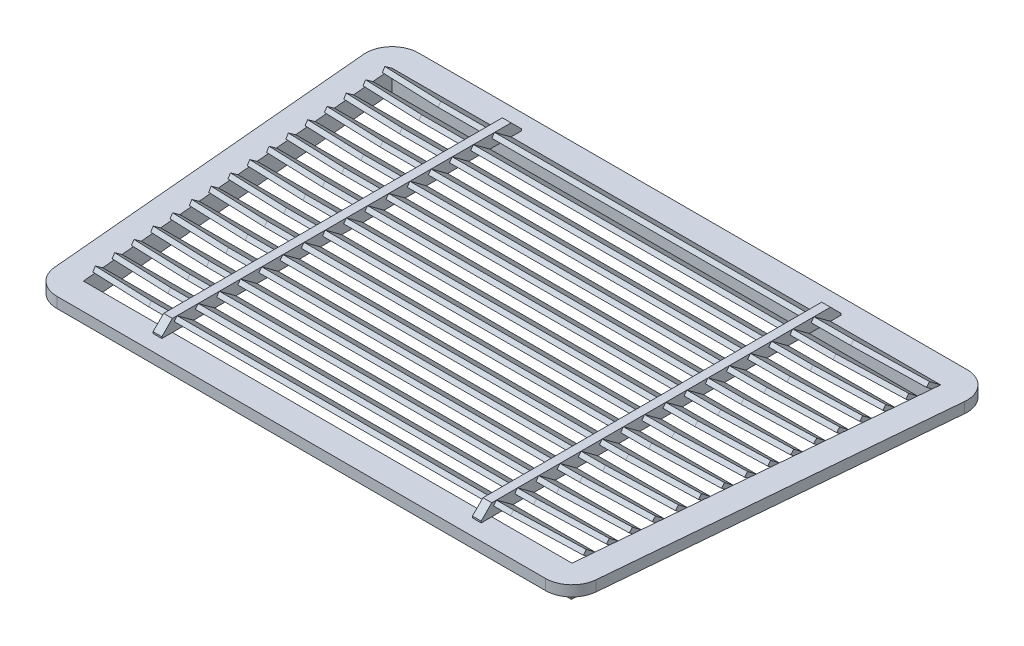
from build123d import *

# Parameters (mm, degrees)
SURFACE_EXTRUDE1_1_BACK         = 40
SURFACE_EXTRUDE1_1_DEPTH        = 40
THICKEN1_T1                     = 20
THICKEN2_START                  = -20
THICKEN2_DEPTH                  = 20
FILLET1_R                       = 50
BOSS_EXTRUDE2_REACH             = 681.192
BOSS_EXTRUDE2_DIRECTION_2_REACH = 681.192
SKETCH8_W                       = 16.546717582
SKETCH8_H                       = 23.062077859
BOSS_EXTRUDE5_DEPTH             = 680
BOSS_EXTRUDE5_2_DEPTH           = 680
CHAMFER1_SIZE                   = 20
CHAMFER2_SIZE                   = 20
CHAMFER3_SIZE                   = 20
CHAMFER4_SIZE                   = 20
CHAMFER5_SIZE                   = 130
CHAMFER5_SIZE2                  = 15
CHAMFER6_SIZE                   = 120
CHAMFER6_SIZE2                  = 20
CHAMFER7_SIZE                   = 120
CHAMFER7_SIZE2                  = 20
CHAMFER8_SIZE                   = 120
CHAMFER8_SIZE2                  = 20
CHAMFER9_SIZE                   = 120
CHAMFER9_SIZE2                  = 20
CHAMFER10_SIZE                  = 120
CHAMFER10_SIZE2                 = 20
CHAMFER11_SIZE                  = 120
CHAMFER11_SIZE2                 = 20
CHAMFER12_SIZE                  = 120
CHAMFER12_SIZE2                 = 20
CHAMFER13_SIZE                  = 120
CHAMFER13_SIZE2                 = 20
CHAMFER14_SIZE                  = 120
CHAMFER14_SIZE2                 = 20
CHAMFER16_SIZE                  = 120
CHAMFER16_SIZE2                 = 20
CHAMFER17_SIZE                  = 120
CHAMFER17_SIZE2                 = 20
CHAMFER18_SIZE                  = 120
CHAMFER18_SIZE2                 = 20
CHAMFER19_SIZE                  = 120
CHAMFER19_SIZE2                 = 20
CHAMFER20_SIZE                  = 120
CHAMFER20_SIZE2                 = 20
CHAMFER21_SIZE                  = 120
CHAMFER21_SIZE2                 = 20
CHAMFER22_SIZE                  = 20
CHAMFER22_SIZE2                 = 120
CHAMFER23_SIZE                  = 20
CHAMFER23_SIZE2                 = 120
CHAMFER24_SIZE                  = 20
CHAMFER24_SIZE2                 = 120
CHAMFER25_SIZE                  = 20
CHAMFER25_SIZE2                 = 120
CHAMFER26_SIZE                  = 20
CHAMFER26_SIZE2                 = 120
CHAMFER27_SIZE                  = 20
CHAMFER27_SIZE2                 = 120
CHAMFER28_SIZE                  = 20
CHAMFER28_SIZE2                 = 120
CHAMFER29_SIZE                  = 20
CHAMFER29_SIZE2                 = 120
CHAMFER30_SIZE                  = 20
CHAMFER30_SIZE2                 = 120
CHAMFER31_SIZE                  = 20
CHAMFER31_SIZE2                 = 120
CHAMFER32_SIZE                  = 20
CHAMFER32_SIZE2                 = 120
CHAMFER33_SIZE                  = 20
CHAMFER33_SIZE2                 = 120
CHAMFER34_SIZE                  = 20
CHAMFER34_SIZE2                 = 120
CHAMFER35_SIZE                  = 20
CHAMFER35_SIZE2                 = 120
CHAMFER36_SIZE                  = 20
CHAMFER36_SIZE2                 = 120
CHAMFER37_SIZE                  = 20
CHAMFER37_SIZE2                 = 120


# Read off the part's stored shape, not the designer's step: Thicken2
with BuildPart() as body_1:
    # Surface-Extrude1: a surface, the sketch's curves swept straight by 40 mm
    with BuildLine(Plane(origin=(0, 0, 0), x_dir=(1, 0, 0), z_dir=(0, 1, 0)).offset(-SURFACE_EXTRUDE1_1_BACK), mode=Mode.PRIVATE) as surface_extrude1_1_path:
        Line((-540, 340), (-479.972491182, -340))
        Line((-479.972491182, -340), (479.972491182, -340))
        Line((479.972491182, -340), (540, 340))
        Line((540, 340), (-540, 340))
    surface_extrude1_1 = Shell.extrude(surface_extrude1_1_path.wire(), (0 * SURFACE_EXTRUDE1_1_DEPTH, 1 * SURFACE_EXTRUDE1_1_DEPTH, 0 * SURFACE_EXTRUDE1_1_DEPTH))
    add(Solid.thicken(surface_extrude1_1, THICKEN1_T1))

    # Thicken2 outline → Thicken2 (add)
    with BuildSketch(Plane(origin=(0, 0, 0), x_dir=(1, 0, 0), z_dir=(0, 1, 0)).offset(THICKEN2_START)):
        Polygon((572.764934729, 370), (-572.764934729, 370), (-507.440881015, -370), (507.440881015, -370), align=None)
        Polygon((-479.972491182, -340), (-540, 340), (540, 340), (479.972491182, -340), align=None, mode=Mode.SUBTRACT)
    extrude(amount=THICKEN2_DEPTH)

    # Fillet1
    fillet1_edges = [body_1.edges().sort_by_distance(p)[0] for p in [
        (-507.440881015, -10, 370),
        (507.440881015, -10, 370),
        (572.764934729, -10, -370),
        (-572.764934729, -10, -370),
    ]]
    fillet(fillet1_edges, radius=FILLET1_R)


with BuildPart() as body_2:
    # Boss-Extrude2: up to this plane
    boss_extrude2_end = Plane(origin=(-520.077473579, 0, -341.758675927), z_dir=(0.9961263210350938, 0, -0.08793379635321903))
    # Sketch6 → Boss-Extrude2 (new, up to the surface)
    with BuildSketch(Plane.ZY, mode=Mode.PRIVATE) as boss_extrude2_sk1:
        Polygon((-320, 0), (-288.774260309, 23.062077859), (-283.541502877, 15.976995481), (-314.767242567, -7.085082378), align=None)
    boss_extrude2_tool1 = split(extrude(boss_extrude2_sk1.sketch, amount=BOSS_EXTRUDE2_REACH, mode=Mode.PRIVATE), bisect_by=boss_extrude2_end, keep=Keep.BOTH, mode=Mode.PRIVATE)
    add(boss_extrude2_tool1.solids().sort_by_distance((0, 7.988498, -301.770751))[0])
    # Sketch6 → Boss-Extrude2 (new, up to the surface)
    with BuildSketch(Plane.ZY, mode=Mode.PRIVATE) as boss_extrude2_sk2:
        Polygon((-280, 0), (-248.774260309, 23.062077859), (-243.541502877, 15.976995481), (-274.767242567, -7.085082378), align=None)
    boss_extrude2_tool2 = split(extrude(boss_extrude2_sk2.sketch, amount=BOSS_EXTRUDE2_REACH, mode=Mode.PRIVATE), bisect_by=boss_extrude2_end, keep=Keep.BOTH, mode=Mode.PRIVATE)
    add(boss_extrude2_tool2.solids().sort_by_distance((0, 7.988498, -261.770751))[0])
    # Sketch6 → Boss-Extrude2 (new, up to the surface)
    with BuildSketch(Plane.ZY, mode=Mode.PRIVATE) as boss_extrude2_sk3:
        Polygon((-240, 0), (-208.774260309, 23.062077859), (-203.541502877, 15.976995481), (-234.767242567, -7.085082378), align=None)
    boss_extrude2_tool3 = split(extrude(boss_extrude2_sk3.sketch, amount=BOSS_EXTRUDE2_REACH, mode=Mode.PRIVATE), bisect_by=boss_extrude2_end, keep=Keep.BOTH, mode=Mode.PRIVATE)
    add(boss_extrude2_tool3.solids().sort_by_distance((0, 7.988498, -221.770751))[0])
    # Sketch6 → Boss-Extrude2 (new, up to the surface)
    with BuildSketch(Plane.ZY, mode=Mode.PRIVATE) as boss_extrude2_sk4:
        Polygon((-200, 0), (-168.774260309, 23.062077859), (-163.541502877, 15.976995481), (-194.767242567, -7.085082378), align=None)
    boss_extrude2_tool4 = split(extrude(boss_extrude2_sk4.sketch, amount=BOSS_EXTRUDE2_REACH, mode=Mode.PRIVATE), bisect_by=boss_extrude2_end, keep=Keep.BOTH, mode=Mode.PRIVATE)
    add(boss_extrude2_tool4.solids().sort_by_distance((0, 7.988498, -181.770751))[0])
    # Sketch6 → Boss-Extrude2 (new, up to the surface)
    with BuildSketch(Plane.ZY, mode=Mode.PRIVATE) as boss_extrude2_sk5:
        Polygon((-160, 0), (-128.774260309, 23.062077859), (-123.541502877, 15.976995481), (-154.767242567, -7.085082378), align=None)
    boss_extrude2_tool5 = split(extrude(boss_extrude2_sk5.sketch, amount=BOSS_EXTRUDE2_REACH, mode=Mode.PRIVATE), bisect_by=boss_extrude2_end, keep=Keep.BOTH, mode=Mode.PRIVATE)
    add(boss_extrude2_tool5.solids().sort_by_distance((0, 7.988498, -141.770751))[0])
    # Sketch6 → Boss-Extrude2 (new, up to the surface)
    with BuildSketch(Plane.ZY, mode=Mode.PRIVATE) as boss_extrude2_sk6:
        Polygon((-120, 0), (-88.774260309, 23.062077859), (-83.541502877, 15.976995481), (-114.767242567, -7.085082378), align=None)
    boss_extrude2_tool6 = split(extrude(boss_extrude2_sk6.sketch, amount=BOSS_EXTRUDE2_REACH, mode=Mode.PRIVATE), bisect_by=boss_extrude2_end, keep=Keep.BOTH, mode=Mode.PRIVATE)
    add(boss_extrude2_tool6.solids().sort_by_distance((0, 7.988498, -101.770751))[0])
    # Sketch6 → Boss-Extrude2 (new, up to the surface)
    with BuildSketch(Plane.ZY, mode=Mode.PRIVATE) as boss_extrude2_sk7:
        Polygon((-80, 0), (-48.774260309, 23.062077859), (-43.541502877, 15.976995481), (-74.767242567, -7.085082378), align=None)
    boss_extrude2_tool7 = split(extrude(boss_extrude2_sk7.sketch, amount=BOSS_EXTRUDE2_REACH, mode=Mode.PRIVATE), bisect_by=boss_extrude2_end, keep=Keep.BOTH, mode=Mode.PRIVATE)
    add(boss_extrude2_tool7.solids().sort_by_distance((0, 7.988498, -61.770751))[0])
    # Sketch6 → Boss-Extrude2 (new, up to the surface)
    with BuildSketch(Plane.ZY, mode=Mode.PRIVATE) as boss_extrude2_sk8:
        Polygon((-40, 0), (-8.774260309, 23.062077859), (-3.541502877, 15.976995481), (-34.767242567, -7.085082378), align=None)
    boss_extrude2_tool8 = split(extrude(boss_extrude2_sk8.sketch, amount=BOSS_EXTRUDE2_REACH, mode=Mode.PRIVATE), bisect_by=boss_extrude2_end, keep=Keep.BOTH, mode=Mode.PRIVATE)
    add(boss_extrude2_tool8.solids().sort_by_distance((0, 7.988498, -21.770751))[0])
    # Sketch6 → Boss-Extrude2 (new, up to the surface)
    with BuildSketch(Plane.ZY, mode=Mode.PRIVATE) as boss_extrude2_sk9:
        Polygon((0, 0), (31.225739691, 23.062077859), (36.458497123, 15.976995481), (5.232757433, -7.085082378), align=None)
    boss_extrude2_tool9 = split(extrude(boss_extrude2_sk9.sketch, amount=BOSS_EXTRUDE2_REACH, mode=Mode.PRIVATE), bisect_by=boss_extrude2_end, keep=Keep.BOTH, mode=Mode.PRIVATE)
    add(boss_extrude2_tool9.solids().sort_by_distance((0, 7.988498, 18.229249))[0])
    # Sketch6 → Boss-Extrude2 (new, up to the surface)
    with BuildSketch(Plane.ZY, mode=Mode.PRIVATE) as boss_extrude2_sk10:
        Polygon((40, 0), (71.225739691, 23.062077859), (76.458497123, 15.976995481), (45.232757433, -7.085082378), align=None)
    boss_extrude2_tool10 = split(extrude(boss_extrude2_sk10.sketch, amount=BOSS_EXTRUDE2_REACH, mode=Mode.PRIVATE), bisect_by=boss_extrude2_end, keep=Keep.BOTH, mode=Mode.PRIVATE)
    add(boss_extrude2_tool10.solids().sort_by_distance((0, 7.988498, 58.229249))[0])
    # Sketch6 → Boss-Extrude2 (new, up to the surface)
    with BuildSketch(Plane.ZY, mode=Mode.PRIVATE) as boss_extrude2_sk11:
        Polygon((80, 0), (111.225739691, 23.062077859), (116.458497123, 15.976995481), (85.232757433, -7.085082378), align=None)
    boss_extrude2_tool11 = split(extrude(boss_extrude2_sk11.sketch, amount=BOSS_EXTRUDE2_REACH, mode=Mode.PRIVATE), bisect_by=boss_extrude2_end, keep=Keep.BOTH, mode=Mode.PRIVATE)
    add(boss_extrude2_tool11.solids().sort_by_distance((0, 7.988498, 98.229249))[0])
    # Sketch6 → Boss-Extrude2 (new, up to the surface)
    with BuildSketch(Plane.ZY, mode=Mode.PRIVATE) as boss_extrude2_sk12:
        Polygon((120, 0), (151.225739691, 23.062077859), (156.458497123, 15.976995481), (125.232757433, -7.085082378), align=None)
    boss_extrude2_tool12 = split(extrude(boss_extrude2_sk12.sketch, amount=BOSS_EXTRUDE2_REACH, mode=Mode.PRIVATE), bisect_by=boss_extrude2_end, keep=Keep.BOTH, mode=Mode.PRIVATE)
    add(boss_extrude2_tool12.solids().sort_by_distance((0, 7.988498, 138.229249))[0])
    # Sketch6 → Boss-Extrude2 (new, up to the surface)
    with BuildSketch(Plane.ZY, mode=Mode.PRIVATE) as boss_extrude2_sk13:
        Polygon((160, 0), (191.225739691, 23.062077859), (196.458497123, 15.976995481), (165.232757433, -7.085082378), align=None)
    boss_extrude2_tool13 = split(extrude(boss_extrude2_sk13.sketch, amount=BOSS_EXTRUDE2_REACH, mode=Mode.PRIVATE), bisect_by=boss_extrude2_end, keep=Keep.BOTH, mode=Mode.PRIVATE)
    add(boss_extrude2_tool13.solids().sort_by_distance((0, 7.988498, 178.229249))[0])
    # Sketch6 → Boss-Extrude2 (new, up to the surface)
    with BuildSketch(Plane.ZY, mode=Mode.PRIVATE) as boss_extrude2_sk14:
        Polygon((200, 0), (231.225739691, 23.062077859), (236.458497123, 15.976995481), (205.232757433, -7.085082378), align=None)
    boss_extrude2_tool14 = split(extrude(boss_extrude2_sk14.sketch, amount=BOSS_EXTRUDE2_REACH, mode=Mode.PRIVATE), bisect_by=boss_extrude2_end, keep=Keep.BOTH, mode=Mode.PRIVATE)
    add(boss_extrude2_tool14.solids().sort_by_distance((0, 7.988498, 218.229249))[0])
    # Sketch6 → Boss-Extrude2 (new, up to the surface)
    with BuildSketch(Plane.ZY, mode=Mode.PRIVATE) as boss_extrude2_sk15:
        Polygon((240, 0), (271.225739691, 23.062077859), (276.458497123, 15.976995481), (245.232757433, -7.085082378), align=None)
    boss_extrude2_tool15 = split(extrude(boss_extrude2_sk15.sketch, amount=BOSS_EXTRUDE2_REACH, mode=Mode.PRIVATE), bisect_by=boss_extrude2_end, keep=Keep.BOTH, mode=Mode.PRIVATE)
    add(boss_extrude2_tool15.solids().sort_by_distance((0, 7.988498, 258.229249))[0])
    # Sketch6 → Boss-Extrude2 (new, up to the surface)
    with BuildSketch(Plane.ZY, mode=Mode.PRIVATE) as boss_extrude2_sk16:
        Polygon((280, 0), (311.225739691, 23.062077859), (316.458497123, 15.976995481), (285.232757433, -7.085082378), align=None)
    boss_extrude2_tool16 = split(extrude(boss_extrude2_sk16.sketch, amount=BOSS_EXTRUDE2_REACH, mode=Mode.PRIVATE), bisect_by=boss_extrude2_end, keep=Keep.BOTH, mode=Mode.PRIVATE)
    add(boss_extrude2_tool16.solids().sort_by_distance((0, 7.988498, 298.229249))[0])

    # Boss-Extrude2 direction 2: up to this plane
    boss_extrude2_direction_2_end = Plane(origin=(460.049964761, 0, 338.241324073), z_dir=(-0.9961263210350938, 0, -0.08793379635321853))
    # Sketch6 → Boss-Extrude2 direction 2 (add, up to the surface)
    with BuildSketch(Plane.ZY, mode=Mode.PRIVATE) as boss_extrude2_direction_2_sk1:
        Polygon((-320, 0), (-288.774260309, 23.062077859), (-283.541502877, 15.976995481), (-314.767242567, -7.085082378), align=None)
    boss_extrude2_direction_2_tool1 = split(extrude(boss_extrude2_direction_2_sk1.sketch, amount=-BOSS_EXTRUDE2_DIRECTION_2_REACH, mode=Mode.PRIVATE), bisect_by=boss_extrude2_direction_2_end, keep=Keep.BOTH, mode=Mode.PRIVATE)
    add(boss_extrude2_direction_2_tool1.solids().sort_by_distance((0, 7.988498, -301.770751))[0])
    # Sketch6 → Boss-Extrude2 direction 2 (add, up to the surface)
    with BuildSketch(Plane.ZY, mode=Mode.PRIVATE) as boss_extrude2_direction_2_sk2:
        Polygon((-280, 0), (-248.774260309, 23.062077859), (-243.541502877, 15.976995481), (-274.767242567, -7.085082378), align=None)
    boss_extrude2_direction_2_tool2 = split(extrude(boss_extrude2_direction_2_sk2.sketch, amount=-BOSS_EXTRUDE2_DIRECTION_2_REACH, mode=Mode.PRIVATE), bisect_by=boss_extrude2_direction_2_end, keep=Keep.BOTH, mode=Mode.PRIVATE)
    add(boss_extrude2_direction_2_tool2.solids().sort_by_distance((0, 7.988498, -261.770751))[0])
    # Sketch6 → Boss-Extrude2 direction 2 (add, up to the surface)
    with BuildSketch(Plane.ZY, mode=Mode.PRIVATE) as boss_extrude2_direction_2_sk3:
        Polygon((-240, 0), (-208.774260309, 23.062077859), (-203.541502877, 15.976995481), (-234.767242567, -7.085082378), align=None)
    boss_extrude2_direction_2_tool3 = split(extrude(boss_extrude2_direction_2_sk3.sketch, amount=-BOSS_EXTRUDE2_DIRECTION_2_REACH, mode=Mode.PRIVATE), bisect_by=boss_extrude2_direction_2_end, keep=Keep.BOTH, mode=Mode.PRIVATE)
    add(boss_extrude2_direction_2_tool3.solids().sort_by_distance((0, 7.988498, -221.770751))[0])
    # Sketch6 → Boss-Extrude2 direction 2 (add, up to the surface)
    with BuildSketch(Plane.ZY, mode=Mode.PRIVATE) as boss_extrude2_direction_2_sk4:
        Polygon((-200, 0), (-168.774260309, 23.062077859), (-163.541502877, 15.976995481), (-194.767242567, -7.085082378), align=None)
    boss_extrude2_direction_2_tool4 = split(extrude(boss_extrude2_direction_2_sk4.sketch, amount=-BOSS_EXTRUDE2_DIRECTION_2_REACH, mode=Mode.PRIVATE), bisect_by=boss_extrude2_direction_2_end, keep=Keep.BOTH, mode=Mode.PRIVATE)
    add(boss_extrude2_direction_2_tool4.solids().sort_by_distance((0, 7.988498, -181.770751))[0])
    # Sketch6 → Boss-Extrude2 direction 2 (add, up to the surface)
    with BuildSketch(Plane.ZY, mode=Mode.PRIVATE) as boss_extrude2_direction_2_sk5:
        Polygon((-160, 0), (-128.774260309, 23.062077859), (-123.541502877, 15.976995481), (-154.767242567, -7.085082378), align=None)
    boss_extrude2_direction_2_tool5 = split(extrude(boss_extrude2_direction_2_sk5.sketch, amount=-BOSS_EXTRUDE2_DIRECTION_2_REACH, mode=Mode.PRIVATE), bisect_by=boss_extrude2_direction_2_end, keep=Keep.BOTH, mode=Mode.PRIVATE)
    add(boss_extrude2_direction_2_tool5.solids().sort_by_distance((0, 7.988498, -141.770751))[0])
    # Sketch6 → Boss-Extrude2 direction 2 (add, up to the surface)
    with BuildSketch(Plane.ZY, mode=Mode.PRIVATE) as boss_extrude2_direction_2_sk6:
        Polygon((-120, 0), (-88.774260309, 23.062077859), (-83.541502877, 15.976995481), (-114.767242567, -7.085082378), align=None)
    boss_extrude2_direction_2_tool6 = split(extrude(boss_extrude2_direction_2_sk6.sketch, amount=-BOSS_EXTRUDE2_DIRECTION_2_REACH, mode=Mode.PRIVATE), bisect_by=boss_extrude2_direction_2_end, keep=Keep.BOTH, mode=Mode.PRIVATE)
    add(boss_extrude2_direction_2_tool6.solids().sort_by_distance((0, 7.988498, -101.770751))[0])
    # Sketch6 → Boss-Extrude2 direction 2 (add, up to the surface)
    with BuildSketch(Plane.ZY, mode=Mode.PRIVATE) as boss_extrude2_direction_2_sk7:
        Polygon((-80, 0), (-48.774260309, 23.062077859), (-43.541502877, 15.976995481), (-74.767242567, -7.085082378), align=None)
    boss_extrude2_direction_2_tool7 = split(extrude(boss_extrude2_direction_2_sk7.sketch, amount=-BOSS_EXTRUDE2_DIRECTION_2_REACH, mode=Mode.PRIVATE), bisect_by=boss_extrude2_direction_2_end, keep=Keep.BOTH, mode=Mode.PRIVATE)
    add(boss_extrude2_direction_2_tool7.solids().sort_by_distance((0, 7.988498, -61.770751))[0])
    # Sketch6 → Boss-Extrude2 direction 2 (add, up to the surface)
    with BuildSketch(Plane.ZY, mode=Mode.PRIVATE) as boss_extrude2_direction_2_sk8:
        Polygon((-40, 0), (-8.774260309, 23.062077859), (-3.541502877, 15.976995481), (-34.767242567, -7.085082378), align=None)
    boss_extrude2_direction_2_tool8 = split(extrude(boss_extrude2_direction_2_sk8.sketch, amount=-BOSS_EXTRUDE2_DIRECTION_2_REACH, mode=Mode.PRIVATE), bisect_by=boss_extrude2_direction_2_end, keep=Keep.BOTH, mode=Mode.PRIVATE)
    add(boss_extrude2_direction_2_tool8.solids().sort_by_distance((0, 7.988498, -21.770751))[0])
    # Sketch6 → Boss-Extrude2 direction 2 (add, up to the surface)
    with BuildSketch(Plane.ZY, mode=Mode.PRIVATE) as boss_extrude2_direction_2_sk9:
        Polygon((0, 0), (31.225739691, 23.062077859), (36.458497123, 15.976995481), (5.232757433, -7.085082378), align=None)
    boss_extrude2_direction_2_tool9 = split(extrude(boss_extrude2_direction_2_sk9.sketch, amount=-BOSS_EXTRUDE2_DIRECTION_2_REACH, mode=Mode.PRIVATE), bisect_by=boss_extrude2_direction_2_end, keep=Keep.BOTH, mode=Mode.PRIVATE)
    add(boss_extrude2_direction_2_tool9.solids().sort_by_distance((0, 7.988498, 18.229249))[0])
    # Sketch6 → Boss-Extrude2 direction 2 (add, up to the surface)
    with BuildSketch(Plane.ZY, mode=Mode.PRIVATE) as boss_extrude2_direction_2_sk10:
        Polygon((40, 0), (71.225739691, 23.062077859), (76.458497123, 15.976995481), (45.232757433, -7.085082378), align=None)
    boss_extrude2_direction_2_tool10 = split(extrude(boss_extrude2_direction_2_sk10.sketch, amount=-BOSS_EXTRUDE2_DIRECTION_2_REACH, mode=Mode.PRIVATE), bisect_by=boss_extrude2_direction_2_end, keep=Keep.BOTH, mode=Mode.PRIVATE)
    add(boss_extrude2_direction_2_tool10.solids().sort_by_distance((0, 7.988498, 58.229249))[0])
    # Sketch6 → Boss-Extrude2 direction 2 (add, up to the surface)
    with BuildSketch(Plane.ZY, mode=Mode.PRIVATE) as boss_extrude2_direction_2_sk11:
        Polygon((80, 0), (111.225739691, 23.062077859), (116.458497123, 15.976995481), (85.232757433, -7.085082378), align=None)
    boss_extrude2_direction_2_tool11 = split(extrude(boss_extrude2_direction_2_sk11.sketch, amount=-BOSS_EXTRUDE2_DIRECTION_2_REACH, mode=Mode.PRIVATE), bisect_by=boss_extrude2_direction_2_end, keep=Keep.BOTH, mode=Mode.PRIVATE)
    add(boss_extrude2_direction_2_tool11.solids().sort_by_distance((0, 7.988498, 98.229249))[0])
    # Sketch6 → Boss-Extrude2 direction 2 (add, up to the surface)
    with BuildSketch(Plane.ZY, mode=Mode.PRIVATE) as boss_extrude2_direction_2_sk12:
        Polygon((120, 0), (151.225739691, 23.062077859), (156.458497123, 15.976995481), (125.232757433, -7.085082378), align=None)
    boss_extrude2_direction_2_tool12 = split(extrude(boss_extrude2_direction_2_sk12.sketch, amount=-BOSS_EXTRUDE2_DIRECTION_2_REACH, mode=Mode.PRIVATE), bisect_by=boss_extrude2_direction_2_end, keep=Keep.BOTH, mode=Mode.PRIVATE)
    add(boss_extrude2_direction_2_tool12.solids().sort_by_distance((0, 7.988498, 138.229249))[0])
    # Sketch6 → Boss-Extrude2 direction 2 (add, up to the surface)
    with BuildSketch(Plane.ZY, mode=Mode.PRIVATE) as boss_extrude2_direction_2_sk13:
        Polygon((160, 0), (191.225739691, 23.062077859), (196.458497123, 15.976995481), (165.232757433, -7.085082378), align=None)
    boss_extrude2_direction_2_tool13 = split(extrude(boss_extrude2_direction_2_sk13.sketch, amount=-BOSS_EXTRUDE2_DIRECTION_2_REACH, mode=Mode.PRIVATE), bisect_by=boss_extrude2_direction_2_end, keep=Keep.BOTH, mode=Mode.PRIVATE)
    add(boss_extrude2_direction_2_tool13.solids().sort_by_distance((0, 7.988498, 178.229249))[0])
    # Sketch6 → Boss-Extrude2 direction 2 (add, up to the surface)
    with BuildSketch(Plane.ZY, mode=Mode.PRIVATE) as boss_extrude2_direction_2_sk14:
        Polygon((200, 0), (231.225739691, 23.062077859), (236.458497123, 15.976995481), (205.232757433, -7.085082378), align=None)
    boss_extrude2_direction_2_tool14 = split(extrude(boss_extrude2_direction_2_sk14.sketch, amount=-BOSS_EXTRUDE2_DIRECTION_2_REACH, mode=Mode.PRIVATE), bisect_by=boss_extrude2_direction_2_end, keep=Keep.BOTH, mode=Mode.PRIVATE)
    add(boss_extrude2_direction_2_tool14.solids().sort_by_distance((0, 7.988498, 218.229249))[0])
    # Sketch6 → Boss-Extrude2 direction 2 (add, up to the surface)
    with BuildSketch(Plane.ZY, mode=Mode.PRIVATE) as boss_extrude2_direction_2_sk15:
        Polygon((240, 0), (271.225739691, 23.062077859), (276.458497123, 15.976995481), (245.232757433, -7.085082378), align=None)
    boss_extrude2_direction_2_tool15 = split(extrude(boss_extrude2_direction_2_sk15.sketch, amount=-BOSS_EXTRUDE2_DIRECTION_2_REACH, mode=Mode.PRIVATE), bisect_by=boss_extrude2_direction_2_end, keep=Keep.BOTH, mode=Mode.PRIVATE)
    add(boss_extrude2_direction_2_tool15.solids().sort_by_distance((0, 7.988498, 258.229249))[0])
    # Sketch6 → Boss-Extrude2 direction 2 (add, up to the surface)
    with BuildSketch(Plane.ZY, mode=Mode.PRIVATE) as boss_extrude2_direction_2_sk16:
        Polygon((280, 0), (311.225739691, 23.062077859), (316.458497123, 15.976995481), (285.232757433, -7.085082378), align=None)
    boss_extrude2_direction_2_tool16 = split(extrude(boss_extrude2_direction_2_sk16.sketch, amount=-BOSS_EXTRUDE2_DIRECTION_2_REACH, mode=Mode.PRIVATE), bisect_by=boss_extrude2_direction_2_end, keep=Keep.BOTH, mode=Mode.PRIVATE)
    add(boss_extrude2_direction_2_tool16.solids().sort_by_distance((0, 7.988498, 298.229249))[0])

    # Chamfer5
    chamfer5_edges = [body_2.edges().sort_by_distance(p)[0] for p in [
        (515.169271855, 19.51953667, -286.157881593),
    ]]
    chamfer5_side = [body_2.faces().sort_by_distance(p)[0] for p in [
        (0, 19.520066072, -286.158272588),
    ]]
    chamfer(chamfer5_edges, length=CHAMFER5_SIZE, length2=CHAMFER5_SIZE2, reference=chamfer5_side[0])

    # Chamfer6
    chamfer6_edges = [body_2.edges().sort_by_distance(p)[0] for p in [
        (511.638241925, 19.51953667, -246.157881593),
    ]]
    chamfer6_side = [body_2.faces().sort_by_distance(p)[0] for p in [
        (0, 19.520069726, -246.158275287),
    ]]
    chamfer(chamfer6_edges, length=CHAMFER6_SIZE, length2=CHAMFER6_SIZE2, reference=chamfer6_side[0])

    # Chamfer7
    chamfer7_edges = [body_2.edges().sort_by_distance(p)[0] for p in [
        (508.107211994, 19.51953667, -206.157881593),
    ]]
    chamfer7_side = [body_2.faces().sort_by_distance(p)[0] for p in [
        (0, 19.52007343, -206.158278023),
    ]]
    chamfer(chamfer7_edges, length=CHAMFER7_SIZE, length2=CHAMFER7_SIZE2, reference=chamfer7_side[0])

    # Chamfer8
    chamfer8_edges = [body_2.edges().sort_by_distance(p)[0] for p in [
        (504.576182064, 19.51953667, -166.157881593),
    ]]
    chamfer8_side = [body_2.faces().sort_by_distance(p)[0] for p in [
        (0, 19.520077187, -166.158280797),
    ]]
    chamfer(chamfer8_edges, length=CHAMFER8_SIZE, length2=CHAMFER8_SIZE2, reference=chamfer8_side[0])

    # Chamfer9
    chamfer9_edges = [body_2.edges().sort_by_distance(p)[0] for p in [
        (501.045152133, 19.51953667, -126.157881593),
    ]]
    chamfer9_side = [body_2.faces().sort_by_distance(p)[0] for p in [
        (0, 19.520080996, -126.15828361),
    ]]
    chamfer(chamfer9_edges, length=CHAMFER9_SIZE, length2=CHAMFER9_SIZE2, reference=chamfer9_side[0])

    # Chamfer10
    chamfer10_edges = [body_2.edges().sort_by_distance(p)[0] for p in [
        (497.514122203, 19.51953667, -86.157881593),
    ]]
    chamfer10_side = [body_2.faces().sort_by_distance(p)[0] for p in [
        (0, 19.520084859, -86.158286463),
    ]]
    chamfer(chamfer10_edges, length=CHAMFER10_SIZE, length2=CHAMFER10_SIZE2, reference=chamfer10_side[0])

    # Chamfer11
    chamfer11_edges = [body_2.edges().sort_by_distance(p)[0] for p in [
        (493.983092273, 19.51953667, -46.157881593),
    ]]
    chamfer11_side = [body_2.faces().sort_by_distance(p)[0] for p in [
        (0, 19.520088778, -46.158289357),
    ]]
    chamfer(chamfer11_edges, length=CHAMFER11_SIZE, length2=CHAMFER11_SIZE2, reference=chamfer11_side[0])

    # Chamfer12
    chamfer12_edges = [body_2.edges().sort_by_distance(p)[0] for p in [
        (490.452062342, 19.51953667, -6.157881593),
    ]]
    chamfer12_side = [body_2.faces().sort_by_distance(p)[0] for p in [
        (0, 19.520092753, -6.158292293),
    ]]
    chamfer(chamfer12_edges, length=CHAMFER12_SIZE, length2=CHAMFER12_SIZE2, reference=chamfer12_side[0])

    # Chamfer13
    chamfer13_edges = [body_2.edges().sort_by_distance(p)[0] for p in [
        (486.921032412, 19.51953667, 33.842118407),
    ]]
    chamfer13_side = [body_2.faces().sort_by_distance(p)[0] for p in [
        (0, 19.520096785, 33.841704729),
    ]]
    chamfer(chamfer13_edges, length=CHAMFER13_SIZE, length2=CHAMFER13_SIZE2, reference=chamfer13_side[0])

    # Chamfer14
    chamfer14_edges = [body_2.edges().sort_by_distance(p)[0] for p in [
        (483.390002481, 19.51953667, 73.842118407),
    ]]
    chamfer14_side = [body_2.faces().sort_by_distance(p)[0] for p in [
        (0, 19.520100877, 73.841701707),
    ]]
    chamfer(chamfer14_edges, length=CHAMFER14_SIZE, length2=CHAMFER14_SIZE2, reference=chamfer14_side[0])

    # Chamfer16
    chamfer16_edges = [body_2.edges().sort_by_distance(p)[0] for p in [
        (479.858972551, 19.51953667, 113.842118407),
    ]]
    chamfer16_side = [body_2.faces().sort_by_distance(p)[0] for p in [
        (0, 19.520105028, 113.841698641),
    ]]
    chamfer(chamfer16_edges, length=CHAMFER16_SIZE, length2=CHAMFER16_SIZE2, reference=chamfer16_side[0])

    # Chamfer17
    chamfer17_edges = [body_2.edges().sort_by_distance(p)[0] for p in [
        (476.32794262, 19.51953667, 153.842118407),
    ]]
    chamfer17_side = [body_2.faces().sort_by_distance(p)[0] for p in [
        (0, 19.520109242, 153.841695529),
    ]]
    chamfer(chamfer17_edges, length=CHAMFER17_SIZE, length2=CHAMFER17_SIZE2, reference=chamfer17_side[0])

    # Chamfer18
    chamfer18_edges = [body_2.edges().sort_by_distance(p)[0] for p in [
        (472.79691269, 19.51953667, 193.842118407),
    ]]
    chamfer18_side = [body_2.faces().sort_by_distance(p)[0] for p in [
        (0, 19.520113518, 193.841692371),
    ]]
    chamfer(chamfer18_edges, length=CHAMFER18_SIZE, length2=CHAMFER18_SIZE2, reference=chamfer18_side[0])

    # Chamfer19
    chamfer19_edges = [body_2.edges().sort_by_distance(p)[0] for p in [
        (469.265882759, 19.51953667, 233.842118407),
    ]]
    chamfer19_side = [body_2.faces().sort_by_distance(p)[0] for p in [
        (0, 19.520117858, 233.841689165),
    ]]
    chamfer(chamfer19_edges, length=CHAMFER19_SIZE, length2=CHAMFER19_SIZE2, reference=chamfer19_side[0])

    # Chamfer20
    chamfer20_edges = [body_2.edges().sort_by_distance(p)[0] for p in [
        (465.734852829, 19.51953667, 273.842118407),
    ]]
    chamfer20_side = [body_2.faces().sort_by_distance(p)[0] for p in [
        (0, 19.520122265, 273.84168591),
    ]]
    chamfer(chamfer20_edges, length=CHAMFER20_SIZE, length2=CHAMFER20_SIZE2, reference=chamfer20_side[0])

    # Chamfer21
    chamfer21_edges = [body_2.edges().sort_by_distance(p)[0] for p in [
        (462.203822898, 19.51953667, 313.842118407),
    ]]
    chamfer21_side = [body_2.faces().sort_by_distance(p)[0] for p in [
        (0, 19.520126738, 313.841682606),
    ]]
    chamfer(chamfer21_edges, length=CHAMFER21_SIZE, length2=CHAMFER21_SIZE2, reference=chamfer21_side[0])

    # Chamfer22
    chamfer22_edges = [body_2.edges().sort_by_distance(p)[0] for p in [
        (-515.169271855, 19.51953667, -286.157881593),
    ]]
    chamfer22_side = [body_2.faces().sort_by_distance(p)[0] for p in [
        (-516.547509624, 7.988497741, -301.770751438),
    ]]
    chamfer(chamfer22_edges, length=CHAMFER22_SIZE, length2=CHAMFER22_SIZE2, reference=chamfer22_side[0])

    # Chamfer23
    chamfer23_edges = [body_2.edges().sort_by_distance(p)[0] for p in [
        (-511.638241925, 19.51953667, -246.157881593),
    ]]
    chamfer23_side = [body_2.faces().sort_by_distance(p)[0] for p in [
        (-513.016479693, 7.988497741, -261.770751438),
    ]]
    chamfer(chamfer23_edges, length=CHAMFER23_SIZE, length2=CHAMFER23_SIZE2, reference=chamfer23_side[0])

    # Chamfer24
    chamfer24_edges = [body_2.edges().sort_by_distance(p)[0] for p in [
        (-508.107211994, 19.51953667, -206.157881593),
    ]]
    chamfer24_side = [body_2.faces().sort_by_distance(p)[0] for p in [
        (-509.485449763, 7.988497741, -221.770751438),
    ]]
    chamfer(chamfer24_edges, length=CHAMFER24_SIZE, length2=CHAMFER24_SIZE2, reference=chamfer24_side[0])

    # Chamfer25
    chamfer25_edges = [body_2.edges().sort_by_distance(p)[0] for p in [
        (-504.576182064, 19.51953667, -166.157881593),
    ]]
    chamfer25_side = [body_2.faces().sort_by_distance(p)[0] for p in [
        (-505.954419832, 7.988497741, -181.770751438),
    ]]
    chamfer(chamfer25_edges, length=CHAMFER25_SIZE, length2=CHAMFER25_SIZE2, reference=chamfer25_side[0])

    # Chamfer26
    chamfer26_edges = [body_2.edges().sort_by_distance(p)[0] for p in [
        (-501.045152133, 19.51953667, -126.157881593),
    ]]
    chamfer26_side = [body_2.faces().sort_by_distance(p)[0] for p in [
        (-502.423389902, 7.988497741, -141.770751438),
    ]]
    chamfer(chamfer26_edges, length=CHAMFER26_SIZE, length2=CHAMFER26_SIZE2, reference=chamfer26_side[0])

    # Chamfer27
    chamfer27_edges = [body_2.edges().sort_by_distance(p)[0] for p in [
        (-497.514122203, 19.51953667, -86.157881593),
    ]]
    chamfer27_side = [body_2.faces().sort_by_distance(p)[0] for p in [
        (-498.892359971, 7.988497741, -101.770751438),
    ]]
    chamfer(chamfer27_edges, length=CHAMFER27_SIZE, length2=CHAMFER27_SIZE2, reference=chamfer27_side[0])

    # Chamfer28
    chamfer28_edges = [body_2.edges().sort_by_distance(p)[0] for p in [
        (-493.983092273, 19.51953667, -46.157881593),
    ]]
    chamfer28_side = [body_2.faces().sort_by_distance(p)[0] for p in [
        (-495.361330041, 7.988497741, -61.770751438),
    ]]
    chamfer(chamfer28_edges, length=CHAMFER28_SIZE, length2=CHAMFER28_SIZE2, reference=chamfer28_side[0])

    # Chamfer29
    chamfer29_edges = [body_2.edges().sort_by_distance(p)[0] for p in [
        (-490.452062342, 19.51953667, -6.157881593),
    ]]
    chamfer29_side = [body_2.faces().sort_by_distance(p)[0] for p in [
        (-491.83030011, 7.988497741, -21.770751438),
    ]]
    chamfer(chamfer29_edges, length=CHAMFER29_SIZE, length2=CHAMFER29_SIZE2, reference=chamfer29_side[0])

    # Chamfer30
    chamfer30_edges = [body_2.edges().sort_by_distance(p)[0] for p in [
        (-486.921032412, 19.51953667, 33.842118407),
    ]]
    chamfer30_side = [body_2.faces().sort_by_distance(p)[0] for p in [
        (-488.29927018, 7.988497741, 18.229248562),
    ]]
    chamfer(chamfer30_edges, length=CHAMFER30_SIZE, length2=CHAMFER30_SIZE2, reference=chamfer30_side[0])

    # Chamfer31
    chamfer31_edges = [body_2.edges().sort_by_distance(p)[0] for p in [
        (-483.390002481, 19.51953667, 73.842118407),
    ]]
    chamfer31_side = [body_2.faces().sort_by_distance(p)[0] for p in [
        (-484.768240249, 7.988497741, 58.229248562),
    ]]
    chamfer(chamfer31_edges, length=CHAMFER31_SIZE, length2=CHAMFER31_SIZE2, reference=chamfer31_side[0])

    # Chamfer32
    chamfer32_edges = [body_2.edges().sort_by_distance(p)[0] for p in [
        (-479.858972551, 19.51953667, 113.842118407),
    ]]
    chamfer32_side = [body_2.faces().sort_by_distance(p)[0] for p in [
        (-481.237210319, 7.988497741, 98.229248562),
    ]]
    chamfer(chamfer32_edges, length=CHAMFER32_SIZE, length2=CHAMFER32_SIZE2, reference=chamfer32_side[0])

    # Chamfer33
    chamfer33_edges = [body_2.edges().sort_by_distance(p)[0] for p in [
        (-476.32794262, 19.51953667, 153.842118407),
    ]]
    chamfer33_side = [body_2.faces().sort_by_distance(p)[0] for p in [
        (-477.706180388, 7.988497741, 138.229248562),
    ]]
    chamfer(chamfer33_edges, length=CHAMFER33_SIZE, length2=CHAMFER33_SIZE2, reference=chamfer33_side[0])

    # Chamfer34
    chamfer34_edges = [body_2.edges().sort_by_distance(p)[0] for p in [
        (-472.79691269, 19.51953667, 193.842118407),
    ]]
    chamfer34_side = [body_2.faces().sort_by_distance(p)[0] for p in [
        (-474.175150458, 7.988497741, 178.229248562),
    ]]
    chamfer(chamfer34_edges, length=CHAMFER34_SIZE, length2=CHAMFER34_SIZE2, reference=chamfer34_side[0])

    # Chamfer35
    chamfer35_edges = [body_2.edges().sort_by_distance(p)[0] for p in [
        (-469.265882759, 19.51953667, 233.842118407),
    ]]
    chamfer35_side = [body_2.faces().sort_by_distance(p)[0] for p in [
        (-470.644120527, 7.988497741, 218.229248562),
    ]]
    chamfer(chamfer35_edges, length=CHAMFER35_SIZE, length2=CHAMFER35_SIZE2, reference=chamfer35_side[0])

    # Chamfer36
    chamfer36_edges = [body_2.edges().sort_by_distance(p)[0] for p in [
        (-465.734852829, 19.51953667, 273.842118407),
    ]]
    chamfer36_side = [body_2.faces().sort_by_distance(p)[0] for p in [
        (-467.113090597, 7.988497741, 258.229248562),
    ]]
    chamfer(chamfer36_edges, length=CHAMFER36_SIZE, length2=CHAMFER36_SIZE2, reference=chamfer36_side[0])

    # Chamfer37
    chamfer37_edges = [body_2.edges().sort_by_distance(p)[0] for p in [
        (-462.203822898, 19.51953667, 313.842118407),
    ]]
    chamfer37_side = [body_2.faces().sort_by_distance(p)[0] for p in [
        (-463.582060666, 7.988497741, 298.229248562),
    ]]
    chamfer(chamfer37_edges, length=CHAMFER37_SIZE, length2=CHAMFER37_SIZE2, reference=chamfer37_side[0])


with BuildPart() as body_3:
    # Sketch8 → Boss-Extrude5 (new body)
    with BuildSketch(Plane(origin=(0, 0, -340), x_dir=(-1, 0, 0), z_dir=(0, 0, -1))):
        with Locations((-301.727485595, 11.53103893)):
            Rectangle(SKETCH8_W, SKETCH8_H)
    extrude(amount=-BOSS_EXTRUDE5_DEPTH)

    # Chamfer2
    chamfer2_edges = [body_3.edges().sort_by_distance(p)[0] for p in [
        (301.727485595, 23.062077859, -340),
    ]]
    chamfer(chamfer2_edges, length=CHAMFER2_SIZE)

    # Chamfer4
    chamfer4_edges = [body_3.edges().sort_by_distance(p)[0] for p in [
        (301.727485595, 23.062077859, 340),
    ]]
    chamfer(chamfer4_edges, length=CHAMFER4_SIZE)


with BuildPart() as body_4:
    # Sketch8 → Boss-Extrude5 2 (new body)
    with BuildSketch(Plane(origin=(0, 0, -340), x_dir=(-1, 0, 0), z_dir=(0, 0, -1))):
        with Locations((301.727485595, 11.53103893)):
            Rectangle(SKETCH8_W, SKETCH8_H)
    extrude(amount=-BOSS_EXTRUDE5_2_DEPTH)

    # Chamfer1
    chamfer1_edges = [body_4.edges().sort_by_distance(p)[0] for p in [
        (-301.727485595, 23.062077859, -340),
    ]]
    chamfer(chamfer1_edges, length=CHAMFER1_SIZE)

    # Chamfer3
    chamfer3_edges = [body_4.edges().sort_by_distance(p)[0] for p in [
        (-301.727485595, 23.062077859, 340),
    ]]
    chamfer(chamfer3_edges, length=CHAMFER3_SIZE)


solid = Compound([body_1.part, body_2.part, body_3.part, body_4.part])
